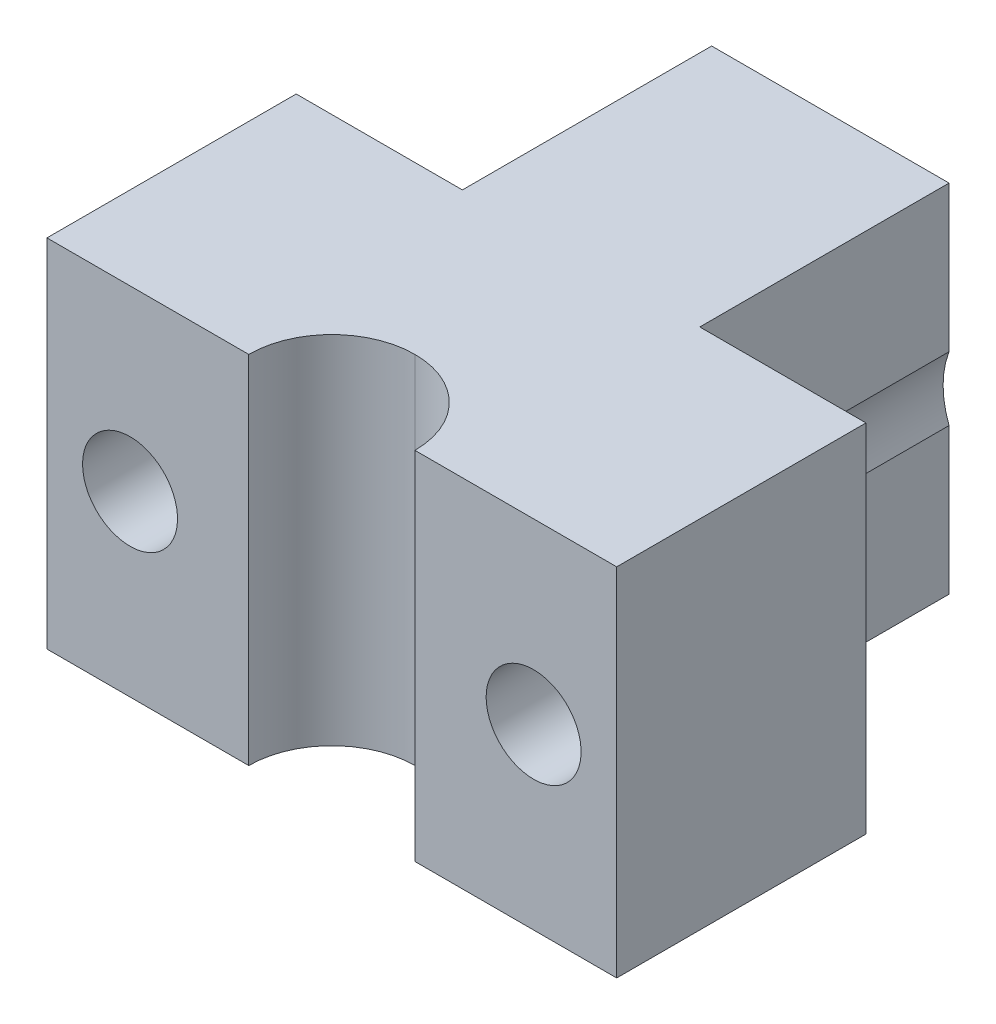
from build123d import *

# Parameters (mm, degrees)
SKETCH_1_W          = 48
SKETCH_1_H          = 20
EXTRUDE_1_DEPTH     = 30
SKETCH_2_W          = 14
SKETCH_2_H          = 30
CUT_EXTRUDE_1_DEPTH = 7
SKETCH_7_W          = 22
SKETCH_7_H          = 30
EXTRUDE_2_DEPTH     = 48
SKETCH_8_W          = 21
SKETCH_8_H          = 30
CUT_EXTRUDE_2_DEPTH = 14
SKETCH_9_W          = 21
SKETCH_9_H          = 30
CUT_EXTRUDE_3_DEPTH = 14
SKETCH_11_W         = 10.2
SKETCH_11_H         = 20.2
CUT_EXTRUDE_4_DEPTH = 56.497747702
SKETCH_13_R         = 4
CUT_EXTRUDE_5_DEPTH = 44.783558558
SKETCH_14_R         = 4
CUT_EXTRUDE_6_DEPTH = 44.783558558
FILLET_1_R          = 7
SKETCH1_W           = 10.2
SKETCH1_H           = 20.2
BOSS_EXTRUDE1_DEPTH = 4
SKETCH_20_R         = 7.5
CUT_EXTRUDE_8_DEPTH = 44.783558558


with BuildPart() as part:
    # Эскиз1 → Бобышка-Вытянуть1 (new body)
    with BuildSketch(Plane(origin=(0, 0, 0), x_dir=(1, 0, 0), z_dir=(0, 1, 0))):
        Rectangle(SKETCH_1_W, SKETCH_1_H)
    extrude(amount=EXTRUDE_1_DEPTH)

    # Эскиз2 → Вырез-Вытянуть1 (cut)
    with BuildSketch(Plane.XY.offset(10)):
        with Locations((0, 15)):
            Rectangle(SKETCH_2_W, SKETCH_2_H)
    extrude(amount=-CUT_EXTRUDE_1_DEPTH, mode=Mode.SUBTRACT)

    # Эскиз7 → Бобышка-Вытянуть2 (add)
    with BuildSketch(Plane(origin=(24, 0, 0), x_dir=(0, 0, -1), z_dir=(1, 0, 0))):
        with Locations((21, 15)):
            Rectangle(SKETCH_7_W, SKETCH_7_H)
    extrude(amount=-EXTRUDE_2_DEPTH)

    # Эскиз8 → Вырез-Вытянуть2 (cut)
    with BuildSketch(Plane(origin=(24, 0, 0), x_dir=(0, 0, -1), z_dir=(1, 0, 0))):
        with Locations((21.5, 15)):
            Rectangle(SKETCH_8_W, SKETCH_8_H)
    extrude(amount=-CUT_EXTRUDE_2_DEPTH, mode=Mode.SUBTRACT)

    # Эскиз9 → Вырез-Вытянуть3 (cut)
    with BuildSketch(Plane.ZY.offset(24)):
        with Locations((-21.5, 15)):
            Rectangle(SKETCH_9_W, SKETCH_9_H)
    extrude(amount=-CUT_EXTRUDE_3_DEPTH, mode=Mode.SUBTRACT)

    # Эскиз11 → Вырез-Вытянуть4 (cut, through all)
    with BuildSketch(Plane.ZY.offset(10)):
        with Locations((-21.5, 15)):
            Rectangle(SKETCH_11_W, SKETCH_11_H)
    extrude(amount=-CUT_EXTRUDE_4_DEPTH, mode=Mode.SUBTRACT)

    # Эскиз13 → Вырез-Вытянуть5 (cut, through all)
    with BuildSketch(Plane(origin=(0, 0, -11), x_dir=(-1, 0, 0), z_dir=(0, 0, -1))):
        with Locations((17, 15)):
            Circle(SKETCH_13_R)
    extrude(amount=-CUT_EXTRUDE_5_DEPTH, mode=Mode.SUBTRACT)

    # Эскиз14 → Вырез-Вытянуть6 (cut, through all)
    with BuildSketch(Plane(origin=(0, 0, -11), x_dir=(-1, 0, 0), z_dir=(0, 0, -1))):
        with Locations((-17, 15)):
            Circle(SKETCH_14_R)
    extrude(amount=-CUT_EXTRUDE_6_DEPTH, mode=Mode.SUBTRACT)

    # Скругление1
    fillet_1_edges = [part.edges().sort_by_distance(p)[0] for p in [
        (-7, 15, 3),
        (7, 15, 3),
    ]]
    fillet(fillet_1_edges, radius=FILLET_1_R - 0.0001)  # a hair under: the kernel refuses the full size

    # Sketch1 → Boss-Extrude1 (add)
    with BuildSketch(Plane(origin=(10, 0, 0), x_dir=(0, 0, -1), z_dir=(1, 0, 0))):
        with Locations((21.5, 15)):
            Rectangle(SKETCH1_W, SKETCH1_H)
    extrude(amount=-BOSS_EXTRUDE1_DEPTH)

    # Эскиз20 → Вырез-Вытянуть8 (cut, through all)
    with BuildSketch(Plane(origin=(0, 0, -11), x_dir=(-1, 0, 0), z_dir=(0, 0, -1))):
        with Locations((-17, 15)):
            Circle(SKETCH_20_R)
        with Locations((17, 15)):
            Circle(SKETCH_20_R)
    extrude(amount=CUT_EXTRUDE_8_DEPTH, mode=Mode.SUBTRACT)


solid = part.part
